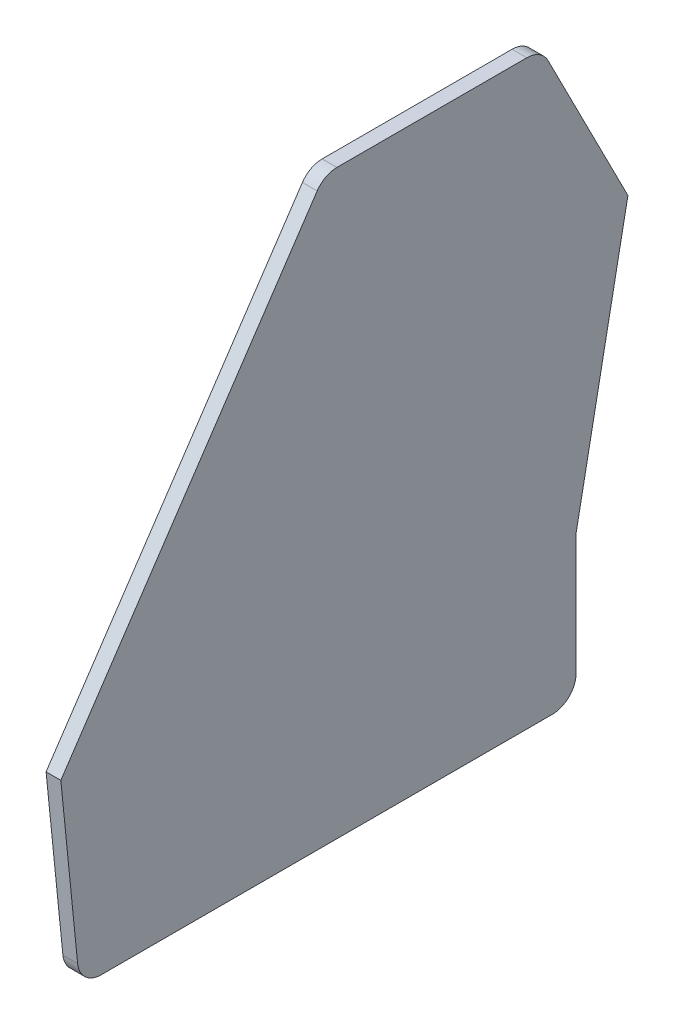
from build123d import *

# Parameters (mm, degrees)
BOSS_EXTRUDE1_DEPTH = 1.5748
FILLET1_R           = 2.54
FILLET2_R           = 2.54
SCALE1_SCALE        = 0.6


with BuildPart() as part:
    # Sketch2 → Boss-Extrude1 (new body)
    with BuildSketch(Plane(origin=(0, 0, 0), x_dir=(0, 0, -1), z_dir=(1, 0, 0))):
        Polygon((0, 0), (53.0352, 0), (53.0352, 15.49908), (58.5724, 43.985504497), (49.328133014, 62.1284), (26.118962015, 62.1284), (-2.028177926, 20.155946526), align=None)
    extrude(amount=BOSS_EXTRUDE1_DEPTH)

    # Fillet1
    fillet1_edges = [part.edges().sort_by_distance(p)[0] for p in [
        (0.7874, 0, 0),
    ]]
    fillet(fillet1_edges, radius=FILLET1_R)

    # Fillet2
    fillet2_edges = [part.edges().sort_by_distance(p)[0] for p in [
        (0.7874, 0, -53.0352),
        (0.7874, 62.1284, -49.328133014),
        (0.7874, 62.1284, -26.118962015),
    ]]
    fillet(fillet2_edges, radius=FILLET2_R)


with BuildPart() as part_1:
    # Scale1: scaled about (0.7874, 27.910865915, -30.360627496)
    add(part.part.scale(SCALE1_SCALE).moved(Location((0.31496, 11.164346366, -12.144250998))))


solid = part_1.part
